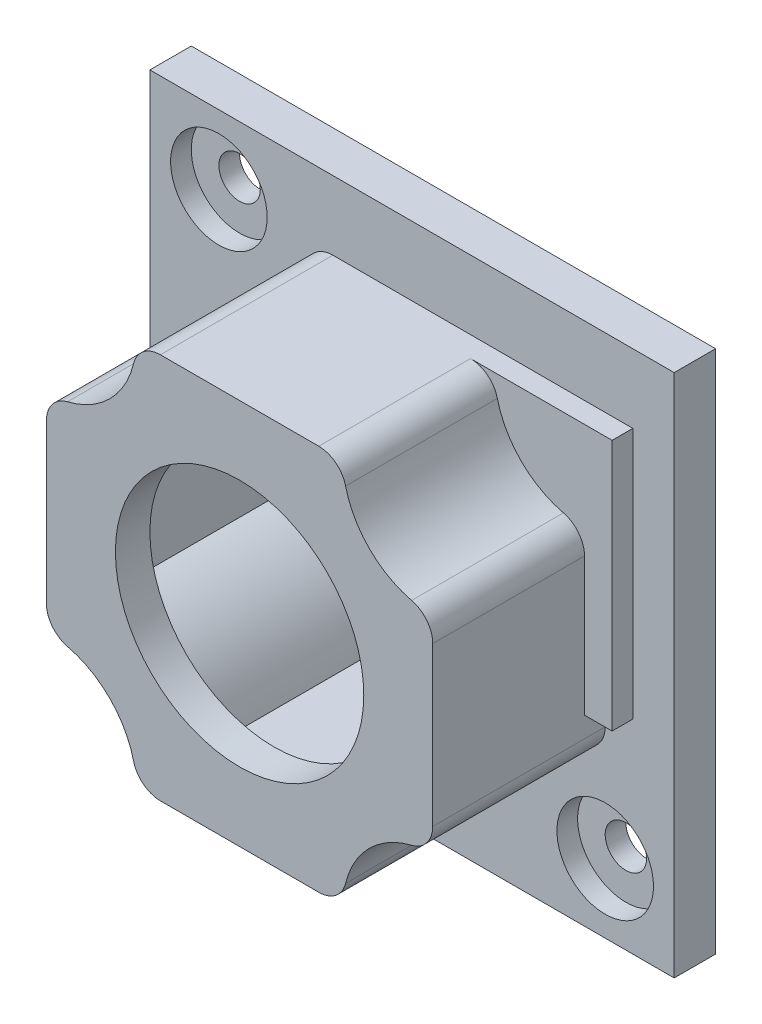
from build123d import *

# Parameters (mm, degrees)
SKETCH1_W           = 38
SKETCH1_H           = 38
BOSS_EXTRUDE1_DEPTH = 3
SKETCH2_R           = 1.5
CUT_EXTRUDE1_DEPTH  = 28.037011669
BOSS_EXTRUDE2_DEPTH = 12.5
SKETCH4_R           = 9
CUT_EXTRUDE2_DEPTH  = 32.020154738
CUT_EXTRUDE3_START  = -2.5
CUT_EXTRUDE3_DEPTH  = 29.520154738
FILLET1_R           = 2
SKETCH6_W           = 8
SKETCH6_H           = 15
CUT_EXTRUDE4_DEPTH  = 2.5
BOSS_EXTRUDE3_START = 1.5
BOSS_EXTRUDE3_DEPTH = 1.5
SKETCH8_R           = 3.5
CUT_EXTRUDE5_DEPTH  = 1.5


with BuildPart() as part:
    # Sketch1 → Boss-Extrude1 (new body)
    with BuildSketch(Plane(origin=(0, 0, 0), x_dir=(0, 1, 0), z_dir=(0, 0, 1))):
        Rectangle(SKETCH1_W, SKETCH1_H)
    extrude(amount=BOSS_EXTRUDE1_DEPTH)

    # Sketch2 → Cut-Extrude1 (cut, through all)
    with BuildSketch(Plane(origin=(0, 0, 0), x_dir=(1, 0, 0), z_dir=(0, 0, -1))):
        with Locations((-14, 14)):
            Circle(SKETCH2_R)
        with Locations((-14, -14)):
            Circle(SKETCH2_R)
        with Locations((14, 14)):
            Circle(SKETCH2_R)
    extrude(amount=-CUT_EXTRUDE1_DEPTH, mode=Mode.SUBTRACT)

    # Sketch3 → Boss-Extrude2 (add)
    with BuildSketch(Plane.XY.offset(3)):
        with BuildLine():
            Line((-14, 7.5), (-14, -7.5))
            ThreePointArc((-14, -7.5), (-9.403805922, -9.403805922), (-7.5, -14))
            Line((-7.5, -14), (7.5, -14))
            ThreePointArc((7.5, -14), (9.403805922, -9.403805922), (14, -7.5))
            Line((14, -7.5), (14, 7.5))
            ThreePointArc((14, 7.5), (9.403805922, 9.403805922), (7.5, 14))
            Line((7.5, 14), (-7.5, 14))
            ThreePointArc((-7.5, 14), (-9.403805922, 9.403805922), (-14, 7.5))
        make_face()
    extrude(amount=BOSS_EXTRUDE2_DEPTH)

    # Sketch4 → Cut-Extrude2 (cut, through all)
    with BuildSketch(Plane.XY.offset(15.5)):
        Circle(SKETCH4_R)
    extrude(amount=-CUT_EXTRUDE2_DEPTH, mode=Mode.SUBTRACT)

    # Sketch5 → Cut-Extrude3 (cut, through all)
    with BuildSketch(Plane.XY.offset(15.5).offset(CUT_EXTRUDE3_START)):
        with BuildLine():
            Line((-11.5, -4.83484861), (-11.5, 4.83484861))
            ThreePointArc((-11.5, 4.83484861), (-7.282485579, 7.282485579), (-4.83484861, 11.5))
            Line((-4.83484861, 11.5), (4.83484861, 11.5))
            ThreePointArc((4.83484861, 11.5), (7.282485579, 7.282485579), (11.5, 4.83484861))
            Line((11.5, 4.83484861), (11.5, -4.83484861))
            ThreePointArc((11.5, -4.83484861), (7.282485579, -7.282485579), (4.83484861, -11.5))
            Line((4.83484861, -11.5), (-4.83484861, -11.5))
            ThreePointArc((-4.83484861, -11.5), (-7.282485579, -7.282485579), (-11.5, -4.83484861))
        make_face()
    extrude(amount=-CUT_EXTRUDE3_DEPTH, mode=Mode.SUBTRACT)

    # Fillet1
    fillet1_edges = [part.edges().sort_by_distance(p)[0] for p in [
        (-14, -7.5, 9.25),
        (-7.5, -14, 9.25),
        (7.5, -14, 9.25),
        (14, -7.5, 9.25),
        (14, 7.5, 9.25),
        (7.5, 14, 9.25),
        (-7.5, 14, 9.25),
        (-14, 7.5, 9.25),
    ]]
    fillet(fillet1_edges, radius=FILLET1_R)

    # Sketch6 → Cut-Extrude4 (cut)
    with BuildSketch(Plane(origin=(0, 0, 0), x_dir=(1, 0, 0), z_dir=(0, 0, -1))):
        with Locations((10.5, -4.75)):
            Rectangle(SKETCH6_W, SKETCH6_H)
    extrude(amount=-CUT_EXTRUDE4_DEPTH, mode=Mode.SUBTRACT)

    # Sketch7 → Boss-Extrude3 (add)
    with BuildSketch(Plane.XY.offset(3).offset(BOSS_EXTRUDE3_START)):
        with BuildLine():
            Line((16, 14), (5.738644179, 14))
            ThreePointArc((5.738644179, 14), (6.975338064, 13.571810496), (7.682492608, 12.470588235))
            ThreePointArc((7.682492608, 12.470588235), (9.403805922, 9.403805922), (12.470588235, 7.682492608))
            ThreePointArc((12.470588235, 7.682492608), (13.571810496, 6.975338064), (14, 5.738644179))
            Line((14, 5.738644179), (14, -4.25))
            Line((14, -4.25), (16, -4.25))
            Line((16, -4.25), (16, 14))
        make_face()
    extrude(amount=-BOSS_EXTRUDE3_DEPTH)

    # Sketch8 → Cut-Extrude5 (cut)
    with BuildSketch(Plane.XY.offset(3)):
        with Locations((-14, 14)):
            Circle(SKETCH8_R)
        with Locations((-14, -14)):
            Circle(SKETCH8_R)
        with Locations((14, -14)):
            Circle(SKETCH8_R)
    extrude(amount=-CUT_EXTRUDE5_DEPTH, mode=Mode.SUBTRACT)


solid = part.part
